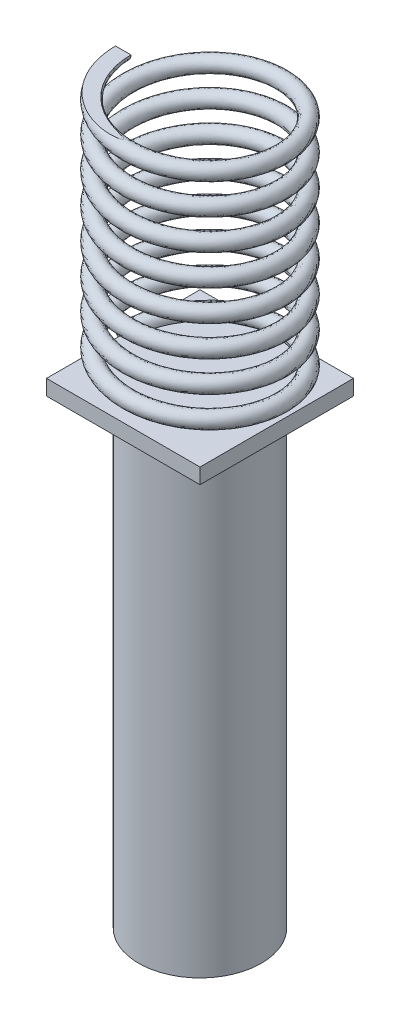
from build123d import *

# Parameters (mm, degrees)
SKETCH_1_W              = 10
SKETCH_1_H              = 10
EXTRUDE_1_DEPTH         = 1
SKETCH_2_R              = 4
EXTRUDE_2_DEPTH         = 30
SWEEP_1_PITCH           = 2
CUT_EXTRUDE_START       = 17
CUT_EXTRUDE_1_OUTLINE_W = 9
CUT_EXTRUDE_1_OUTLINE_H = 9
CUT_EXTRUDE_1_DEPTH     = 0.498989858


# Read off the part's stored shape, not the designer's step: 切除-拉伸1
with BuildPart() as part:
    # 草图1 → 凸台-拉伸1 (new body)
    with BuildSketch(Plane(origin=(0, 0, 0), x_dir=(1, 0, 0), z_dir=(0, 1, 0))):
        Rectangle(SKETCH_1_W, SKETCH_1_H)
    extrude(amount=EXTRUDE_1_DEPTH)

    # 草图2 → 凸台-拉伸2 (add)
    with BuildSketch(Plane.XZ):
        with Locations(Location((0, 0, 0), (0, 0, 270))):
            Circle(SKETCH_2_R)
    extrude(amount=EXTRUDE_2_DEPTH)

    # 扫描1: the profile of 扫描1 profile screwed along a left-hand helix of 8 turns, 10 arcs to a turn; built about Z, then put on its axis
    sweep_1_z = Axis((0, 0, 0), (0, 0, 1))
    sweep_1_corners = [(5, -0.031766681, -0.498989858), (5.5, 0, 0), (5, 0.031766681, 0.498989858), (4.5, 0, 0)]
    with BuildLine(mode=Mode.PRIVATE) as sweep_1_profile:
        ThreePointArc((5, -0.031766681, -0.498989858), (5.353553391, -0.022462436, -0.352839112), (5.5, 0, 0))
        ThreePointArc((5.5, 0, 0), (5.353553391, 0.022462436, 0.352839112), (5, 0.031766681, 0.498989858))
        ThreePointArc((5, 0.031766681, 0.498989858), (4.646446609, 0.022462436, 0.352839112), (4.5, 0, 0))
        ThreePointArc((4.5, 0, 0), (4.646446609, -0.022462436, -0.352839112), (5, -0.031766681, -0.498989858))
    sweep_1_cap = Face(sweep_1_profile.wire())
    sweep_1_arcs = [((5, -0.031766681, -0.498989858), (5.5, -0.031766681, -0.498989858), (5.5, 0, 0), (1, 0.7071067811865476, 1)), ((5.5, 0, 0), (5.5, 0.031766681, 0.498989858), (5, 0.031766681, 0.498989858), (1, 0.7071067811865476, 1)), ((5, 0.031766681, 0.498989858), (4.5, 0.031766681, 0.498989858), (4.5, 0, 0), (1, 0.7071067811865476, 1)), ((4.5, 0, 0), (4.5, -0.031766681, -0.498989858), (5, -0.031766681, -0.498989858), (1, 0.7071067811865476, 1))]  # start, shoulder, end, weights
    sweep_1_turn_angles = [0, -18, -36, -54, -72, -90, -108, -126, -144, -162, -180, -198, -216, -234, -252, -270, -288, -306, -324, -342, -360]
    sweep_1_turn_weights = [1, 0.9510565162951535, 1, 0.9510565162951535, 1, 0.9510565162951535, 1, 0.9510565162951535, 1, 0.9510565162951535, 1, 0.9510565162951535, 1, 0.9510565162951535, 1, 0.9510565162951535, 1, 0.9510565162951535, 1, 0.9510565162951535, 1]
    sweep_1_turn_sides = [Face.make_bezier_surface([[Vector(p[j][0], p[j][1], 0).rotate(sweep_1_z, sweep_1_turn_angles[2 * i + k]) / sweep_1_turn_weights[2 * i + k] + Vector(0, 0, p[j][2] + -SWEEP_1_PITCH * sweep_1_turn_angles[2 * i + k] / 360) for k in range(3)] for j in range(3)], [[p[3][j] * sweep_1_turn_weights[2 * i + k] for k in range(3)] for j in range(3)]) for p in sweep_1_arcs for i in range(10)]
    sweep_1 = Plane(origin=(0, 1, 0), x_dir=(-1, 0, 0), z_dir=(0, 1, 0)) * Solid(Shell([*[p.moved(Location((0, 0, SWEEP_1_PITCH * i))) for i in range(8) for p in sweep_1_turn_sides], sweep_1_cap, sweep_1_cap.rotate(sweep_1_z, -2880).moved(Location((0, 0, -SWEEP_1_PITCH * -2880 / 360)))]))
    add(sweep_1)

    # 切除-拉伸1 outline → 切除-拉伸1 (cut)
    with BuildSketch(Plane(origin=(0, 0, 0), x_dir=(1, 0, 0), z_dir=(0, 1, 0)).offset(CUT_EXTRUDE_START)):
        with Locations((-2.5, -2.5)):
            Rectangle(CUT_EXTRUDE_1_OUTLINE_W, CUT_EXTRUDE_1_OUTLINE_H)
    extrude(amount=CUT_EXTRUDE_1_DEPTH, mode=Mode.SUBTRACT)


solid = part.part
